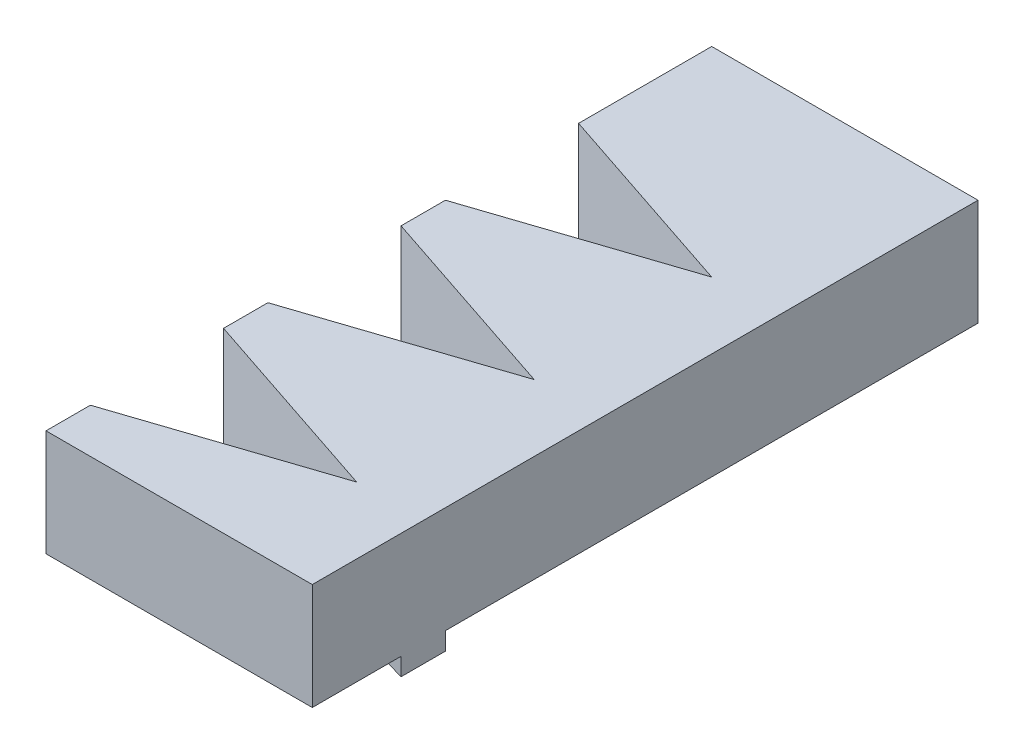
from build123d import *

# Parameters (mm, degrees)
SKETCH1_W           = 30
SKETCH1_H           = 75
BOSS_EXTRUDE1_DEPTH = 12
CUT_EXTRUDE1_DEPTH  = 12
LPATTERN1_COUNT     = 3
LPATTERN1_PITCH     = 20
BOUNDARY2_START     = -15
BOUNDARY2_DEPTH     = 5


# Read off the part's stored shape, not the designer's step: Boundary2
with BuildPart() as part:
    # Sketch1 → Boss-Extrude1 (new body)
    with BuildSketch(Plane(origin=(0, 0, 0), x_dir=(1, 0, 0), z_dir=(0, 1, 0))):
        with Locations((15, 37.5)):
            Rectangle(SKETCH1_W, SKETCH1_H)
    extrude(amount=BOSS_EXTRUDE1_DEPTH)

    # Sketch3 → Cut-Extrude1 (cut)
    with BuildSketch(Plane(origin=(0, 0, 0), x_dir=(1, 0, 0), z_dir=(0, 1, 0))):
        Polygon((0, 5), (22.5, 12.5), (0, 20), align=None)
    cut_extrude1 = extrude(amount=CUT_EXTRUDE1_DEPTH, mode=Mode.SUBTRACT)

    # LPattern1: Cut-Extrude1 ×3
    with Locations(*[(0, 0, -i * LPATTERN1_PITCH) for i in range(1, LPATTERN1_COUNT)]):
        add(cut_extrude1, mode=Mode.SUBTRACT)

    # Boundary2 outline → Boundary2 (add)
    with BuildSketch(Plane.XY.offset(BOUNDARY2_START)):
        Polygon((30, 0), (25, 0), (30, -2), align=None)
    extrude(amount=BOUNDARY2_DEPTH)


solid = part.part
